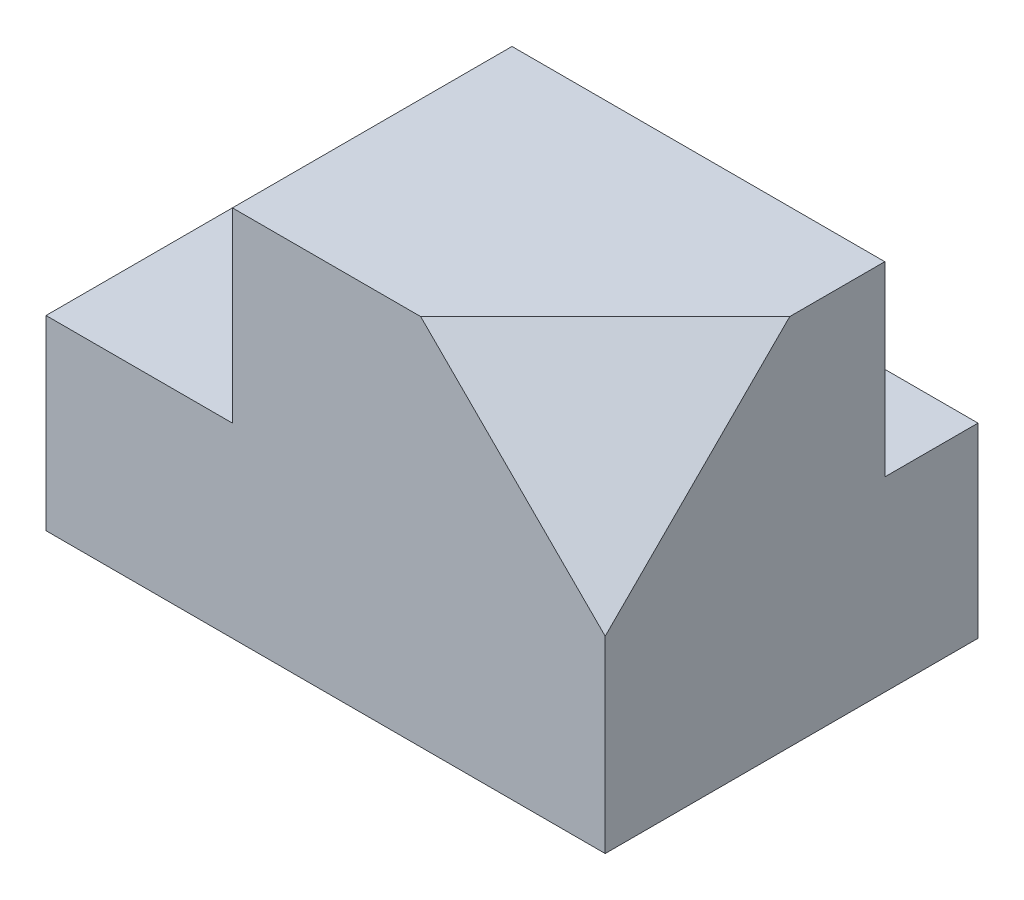
from build123d import *

# Parameters (mm, degrees)
CROQUIS1_W              = 60
CROQUIS1_H              = 40
SALIENTE_EXTRUIR2_DEPTH = 20
CROQUIS3_W              = 40
CROQUIS3_H              = 30
SALIENTE_EXTRUIR3_DEPTH = 20
CHAFL_N1_START          = 40.529988897
CHAFL_N1_OUTLINE_W      = 28
CHAFL_N1_OUTLINE_H      = 31
CHAFL_N1_DEPTH          = 12.470011103


with BuildPart() as part:
    # Croquis1 → Saliente-Extruir2 (new body)
    with BuildSketch(Plane(origin=(0, 0, 0), x_dir=(1, 0, 0), z_dir=(0, 1, 0))):
        Rectangle(CROQUIS1_W, CROQUIS1_H)
    extrude(amount=SALIENTE_EXTRUIR2_DEPTH)

    # Croquis3 → Saliente-Extruir3 (add)
    with BuildSketch(Plane(origin=(0, 20, 0), x_dir=(1, 0, 0), z_dir=(0, 1, 0))):
        with Locations((10, -5)):
            Rectangle(CROQUIS3_W, CROQUIS3_H)
    extrude(amount=SALIENTE_EXTRUIR3_DEPTH)

    # Chaflán1: read off the stored shape, not the designer's step
    # Chaflán1 outline → Chaflán1 (cut)
    with BuildSketch(Plane(origin=(0, 0, 0), x_dir=(0.8164965809277258, -0.40824829046386313, -0.40824829046386313), z_dir=(0.5773502691896258, 0.5773502691896258, 0.5773502691896258)).offset(CHAFL_N1_START)):
        with Locations((-4, 14.5)):
            Rectangle(CHAFL_N1_OUTLINE_W, CHAFL_N1_OUTLINE_H)
    extrude(amount=CHAFL_N1_DEPTH, mode=Mode.SUBTRACT)


solid = part.part
